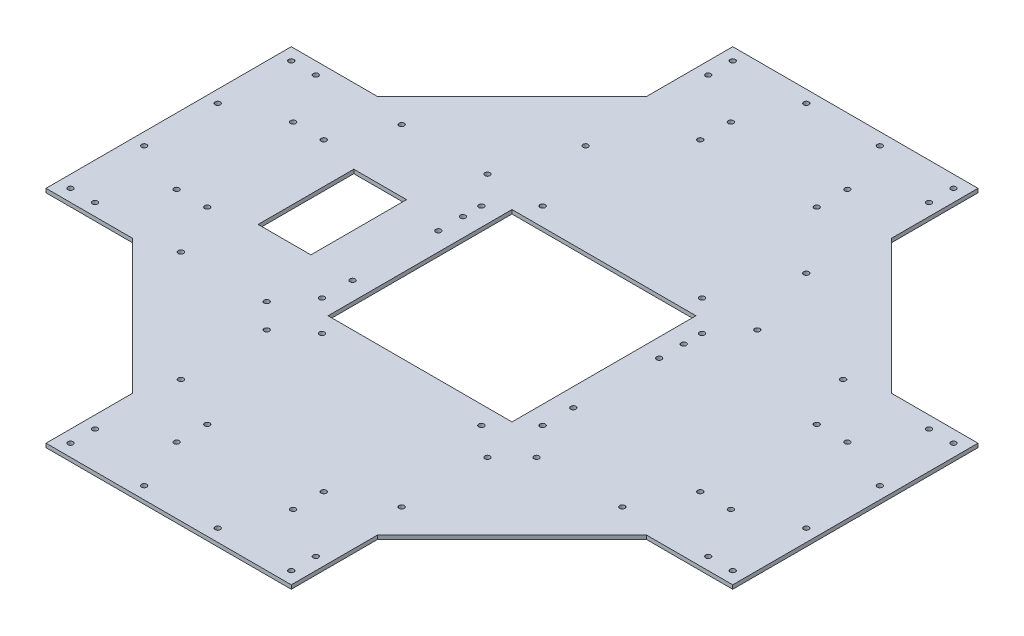
from build123d import *

# Parameters (mm, degrees)
SKETCH1_R           = 2.125
BOSS_EXTRUDE1_DEPTH = 3.175
SKETCH2_R           = 2.125
SKETCH2_W           = 150
SKETCH2_H           = 150
SKETCH2_W_2         = 43
SKETCH2_H_2         = 78
CUT_EXTRUDE1_DEPTH  = 396.992525971


with BuildPart() as part:
    # Sketch1 → Boss-Extrude1 (new body)
    with BuildSketch(Plane(origin=(0, 0, 0), x_dir=(1, 0, 0), z_dir=(0, 1, 0))):
        Polygon((-100, -280), (0, -280), (100, -280), (100, -209.601551084), (209.601551084, -100), (280, -100), (280, 0), (280, 100), (209.601551084, 100), (100, 209.601551084), (100, 280), (0, 280), (-100, 280), (-100, 209.601551084), (-209.601551084, 100), (-280, 100), (-280, 0), (-280, -100), (-209.601551084, -100), (-100, -209.601551084), align=None)
        with Locations((-90, -270)):
            Circle(SKETCH1_R, mode=Mode.SUBTRACT)
        with Locations((-90, -250)):
            Circle(SKETCH1_R, mode=Mode.SUBTRACT)
        with Locations((-30, -270)):
            Circle(SKETCH1_R, mode=Mode.SUBTRACT)
        with Locations((-47.5, -226)):
            Circle(SKETCH1_R, mode=Mode.SUBTRACT)
        with Locations((-90, -180)):
            Circle(SKETCH1_R, mode=Mode.SUBTRACT)
        with Locations((-47.5, -201)):
            Circle(SKETCH1_R, mode=Mode.SUBTRACT)
        with Locations((-270, -90)):
            Circle(SKETCH1_R, mode=Mode.SUBTRACT)
        with Locations((-250, -90)):
            Circle(SKETCH1_R, mode=Mode.SUBTRACT)
        with Locations((-180, -90)):
            Circle(SKETCH1_R, mode=Mode.SUBTRACT)
        with Locations((-226, -47.5)):
            Circle(SKETCH1_R, mode=Mode.SUBTRACT)
        with Locations((-270, -30)):
            Circle(SKETCH1_R, mode=Mode.SUBTRACT)
        with Locations((-201, -47.5)):
            Circle(SKETCH1_R, mode=Mode.SUBTRACT)
        with Locations((-90, -110)):
            Circle(SKETCH1_R, mode=Mode.SUBTRACT)
        with Locations((-110, -90)):
            Circle(SKETCH1_R, mode=Mode.SUBTRACT)
        with Locations((-90, -40)):
            Circle(SKETCH1_R, mode=Mode.SUBTRACT)
        with Locations((30, -270)):
            Circle(SKETCH1_R, mode=Mode.SUBTRACT)
        with Locations((47.5, -226)):
            Circle(SKETCH1_R, mode=Mode.SUBTRACT)
        with Locations((90, -270)):
            Circle(SKETCH1_R, mode=Mode.SUBTRACT)
        with Locations((90, -250)):
            Circle(SKETCH1_R, mode=Mode.SUBTRACT)
        with Locations((47.5, -201)):
            Circle(SKETCH1_R, mode=Mode.SUBTRACT)
        with Locations((90, -180)):
            Circle(SKETCH1_R, mode=Mode.SUBTRACT)
        with Locations((90, -110)):
            Circle(SKETCH1_R, mode=Mode.SUBTRACT)
        with Locations((110, -90)):
            Circle(SKETCH1_R, mode=Mode.SUBTRACT)
        with Locations((90, -40)):
            Circle(SKETCH1_R, mode=Mode.SUBTRACT)
        with Locations((180, -90)):
            Circle(SKETCH1_R, mode=Mode.SUBTRACT)
        with Locations((250, -90)):
            Circle(SKETCH1_R, mode=Mode.SUBTRACT)
        with Locations((270, -90)):
            Circle(SKETCH1_R, mode=Mode.SUBTRACT)
        with Locations((201, -47.5)):
            Circle(SKETCH1_R, mode=Mode.SUBTRACT)
        with Locations((226, -47.5)):
            Circle(SKETCH1_R, mode=Mode.SUBTRACT)
        with Locations((270, -30)):
            Circle(SKETCH1_R, mode=Mode.SUBTRACT)
        with Locations((-270, 30)):
            Circle(SKETCH1_R, mode=Mode.SUBTRACT)
        with Locations((-226, 47.5)):
            Circle(SKETCH1_R, mode=Mode.SUBTRACT)
        with Locations((-201, 47.5)):
            Circle(SKETCH1_R, mode=Mode.SUBTRACT)
        with Locations((-270, 90)):
            Circle(SKETCH1_R, mode=Mode.SUBTRACT)
        with Locations((-250, 90)):
            Circle(SKETCH1_R, mode=Mode.SUBTRACT)
        with Locations((-180, 90)):
            Circle(SKETCH1_R, mode=Mode.SUBTRACT)
        with Locations((-90, 30)):
            Circle(SKETCH1_R, mode=Mode.SUBTRACT)
        with Locations((-90, 50)):
            Circle(SKETCH1_R, mode=Mode.SUBTRACT)
        with Locations((-110, 90)):
            Circle(SKETCH1_R, mode=Mode.SUBTRACT)
        with Locations((-90, 150)):
            Circle(SKETCH1_R, mode=Mode.SUBTRACT)
        with Locations((-47.5, 201)):
            Circle(SKETCH1_R, mode=Mode.SUBTRACT)
        with Locations((-90, 250)):
            Circle(SKETCH1_R, mode=Mode.SUBTRACT)
        with Locations((-90, 270)):
            Circle(SKETCH1_R, mode=Mode.SUBTRACT)
        with Locations((-47.5, 226)):
            Circle(SKETCH1_R, mode=Mode.SUBTRACT)
        with Locations((-30, 270)):
            Circle(SKETCH1_R, mode=Mode.SUBTRACT)
        with Locations((90, 30)):
            Circle(SKETCH1_R, mode=Mode.SUBTRACT)
        with Locations((90, 50)):
            Circle(SKETCH1_R, mode=Mode.SUBTRACT)
        with Locations((110, 90)):
            Circle(SKETCH1_R, mode=Mode.SUBTRACT)
        with Locations((201, 47.5)):
            Circle(SKETCH1_R, mode=Mode.SUBTRACT)
        with Locations((270, 30)):
            Circle(SKETCH1_R, mode=Mode.SUBTRACT)
        with Locations((226, 47.5)):
            Circle(SKETCH1_R, mode=Mode.SUBTRACT)
        with Locations((180, 90)):
            Circle(SKETCH1_R, mode=Mode.SUBTRACT)
        with Locations((250, 90)):
            Circle(SKETCH1_R, mode=Mode.SUBTRACT)
        with Locations((270, 90)):
            Circle(SKETCH1_R, mode=Mode.SUBTRACT)
        with Locations((47.5, 201)):
            Circle(SKETCH1_R, mode=Mode.SUBTRACT)
        with Locations((90, 150)):
            Circle(SKETCH1_R, mode=Mode.SUBTRACT)
        with Locations((47.5, 226)):
            Circle(SKETCH1_R, mode=Mode.SUBTRACT)
        with Locations((30, 270)):
            Circle(SKETCH1_R, mode=Mode.SUBTRACT)
        with Locations((90, 250)):
            Circle(SKETCH1_R, mode=Mode.SUBTRACT)
        with Locations((90, 270)):
            Circle(SKETCH1_R, mode=Mode.SUBTRACT)
    extrude(amount=BOSS_EXTRUDE1_DEPTH)

    # Sketch2 → Cut-Extrude1 (cut, through all)
    with BuildSketch(Plane(origin=(0, 3.175, 0), x_dir=(1, 0, 0), z_dir=(0, 1, 0))):
        with Locations((-90, 65)):
            Circle(SKETCH2_R)
        with Locations((-90, -65)):
            Circle(SKETCH2_R)
        with Locations((90, -65)):
            Circle(SKETCH2_R)
        with Locations((90, 65)):
            Circle(SKETCH2_R)
        with Locations((-65, 90)):
            Circle(SKETCH2_R)
        with Locations((65, 90)):
            Circle(SKETCH2_R)
        with Locations((65, -90)):
            Circle(SKETCH2_R)
        with Locations((-65, -90)):
            Circle(SKETCH2_R)
        Rectangle(SKETCH2_W, SKETCH2_H)
        with Locations((-146.5, 0)):
            Rectangle(SKETCH2_W_2, SKETCH2_H_2)
    extrude(amount=-CUT_EXTRUDE1_DEPTH, mode=Mode.SUBTRACT)


solid = part.part
